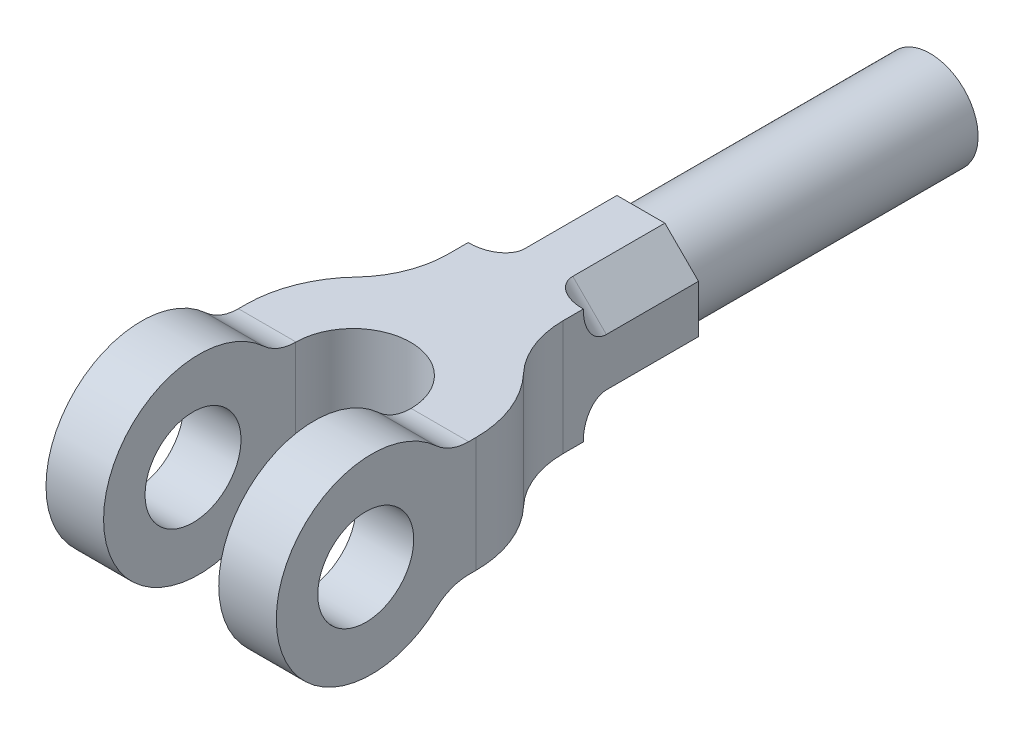
from build123d import *
from build123d.topology import SkipClean

# Parameters (mm, degrees)
SKETCH2_W                = 120
SKETCH2_H                = 250
BOSS_EXTRUDE1_DEPTH      = 50
CUT_EXTRUDE1_DEPTH       = 295.78805946
CUT_EXTRUDE1_DEPTH_BACK  = 295.78805946
CUT_EXTRUDE2_DEPTH       = 100
CUT_EXTRUDE3_DEPTH       = 282.780056072
CUT_EXTRUDE3_DEPTH_BACK  = 282.780056072
FILLET1_R                = 25
CUT_EXTRUDE5_DEPTH       = 60
FILLET4_R                = 12
SKETCH8_R                = 25
BOSS_EXTRUDE2_DEPTH      = 150.7
CUT_EXTRUDE11_DEPTH      = 422.260596346
CUT_EXTRUDE11_DEPTH_BACK = 422.260596346
SKETCH9_R                = 25


with BuildPart() as part:
    # Sketch2 → Boss-Extrude1 (new, symmetric)
    with BuildSketch(Plane(origin=(0, 0, 0), x_dir=(1, 0, 0), z_dir=(0, 1, 0))):
        with Locations((-60, 125)):
            Rectangle(SKETCH2_W, SKETCH2_H)
    extrude(amount=BOSS_EXTRUDE1_DEPTH, both=True)

    # Sketch3 → Cut-Extrude1 (cut, two sides: drawn at the far end of the back side and taken through both)
    with BuildSketch(Plane(origin=(0, 50, 0), x_dir=(1, 0, 0), z_dir=(0, 1, 0)).offset(-CUT_EXTRUDE1_DEPTH_BACK)):
        with BuildLine():
            ThreePointArc((-30, 100), (-60, 130), (-90, 100))
            Line((-90, 100), (-90, 0))
            Line((-90, 0), (-30, 0))
            Line((-30, 0), (-30, 100))
        make_face()
        with BuildLine():
            Line((-120, 250), (-120, 104))
            ThreePointArc((-120, 104), (-115.759222637, 126.156468376), (-103.636363636, 145.180915101))
            ThreePointArc((-103.636363636, 145.180915101), (-93.533981136, 161.034620706), (-90, 179.498344353))
            Line((-90, 179.498344353), (-90, 250))
            Line((-90, 250), (-120, 250))
        make_face()
        with BuildLine():
            ThreePointArc((-16.363636364, 145.180915101), (-4.240777363, 126.156468376), (0, 104))
            Line((0, 104), (0, 250))
            Line((0, 250), (-30, 250))
            Line((-30, 250), (-30, 179.498344353))
            ThreePointArc((-30, 179.498344353), (-26.466018864, 161.034620706), (-16.363636364, 145.180915101))
        make_face()
    extrude(amount=CUT_EXTRUDE1_DEPTH + CUT_EXTRUDE1_DEPTH_BACK, mode=Mode.SUBTRACT)

    # Sketch4 → Cut-Extrude2 (cut)
    with BuildSketch(Plane(origin=(0, 0, 0), x_dir=(0, 0, -1), z_dir=(1, 0, 0))):
        with BuildLine():
            ThreePointArc((89.331663554, -30.296760633), (71.831443345, -44.802429848), (49.703239367, -50))
            Line((49.703239367, -50), (250, -50))
            Line((250, -50), (250, -30.296760633))
            Line((250, -30.296760633), (89.331663554, -30.296760633))
        make_face()
        with BuildLine():
            Line((0, -50), (49.703239367, -50))
            ThreePointArc((49.703239367, -50), (14.557741777, -35.442258249), (0, -0.29676067))
            Line((0, -0.29676067), (0, -50))
        make_face()
        with BuildLine():
            Line((0, 50), (0, -0.29676067))
            ThreePointArc((0, -0.29676067), (33.879981934, 46.820502952), (89.331663554, 29.703239367))
            Line((89.331663554, 29.703239367), (250, 29.703239367))
            Line((250, 29.703239367), (250, 50))
            Line((250, 50), (0, 50))
        make_face()
    extrude(amount=-CUT_EXTRUDE2_DEPTH, mode=Mode.SUBTRACT)

    # Sketch5 → Cut-Extrude3 (cut, two sides: drawn at the far end of the back side and taken through both)
    with SkipClean():  # the faces are left unmerged after this step: merging them gives an invalid solid
        with BuildSketch(Plane(origin=(0, 0, 0), x_dir=(0, 0, -1), z_dir=(1, 0, 0)).offset(-CUT_EXTRUDE3_DEPTH_BACK)):
            with BuildLine():
                Line((89.331663554, 29.703239367), (149.498344353, 29.703239367))
                Line((149.498344353, 29.703239367), (149.498344353, 50))
                Line((149.498344353, 50), (0, 50))
                Line((0, 50), (0, -0.296760633))
                ThreePointArc((0, -0.296760633), (33.879981952, 46.820502958), (89.331663554, 29.703239367))
            make_face()
            with BuildLine():
                Line((149.498344353, -30.296760633), (89.331663554, -30.296760633))
                ThreePointArc((89.331663554, -30.296760633), (71.831443345, -44.802429848), (49.703239367, -50))
                Line((49.703239367, -50), (149.498344353, -50))
                Line((149.498344353, -50), (149.498344353, -30.296760633))
            make_face()
            with BuildLine():
                ThreePointArc((49.703239367, -50), (14.557741764, -35.442258236), (0, -0.296760633))
                Line((0, -0.296760633), (0, -50))
                Line((0, -50), (49.703239367, -50))
            make_face()
        extrude(amount=CUT_EXTRUDE3_DEPTH + CUT_EXTRUDE3_DEPTH_BACK, mode=Mode.SUBTRACT)

    # Fillet1
    fillet1_edges = [part.edges().sort_by_distance(p)[0] for p in [
        (-15, -30.296760633, -89.331663554),
    ]]
    fillet(fillet1_edges, radius=FILLET1_R)
    fillet1_2_edges = [part.edges().sort_by_distance(p)[0] for p in [
        (-95, -30.296760633, -89.331663554),
        (-110, -30.296760633, -89.331663554),
    ]]
    fillet(fillet1_2_edges, radius=FILLET1_R)
    fillet1_3_edges = [part.edges().sort_by_distance(p)[0] for p in [
        (-95, 29.703239367, -89.331663554),
        (-110, 29.703239367, -89.331663554),
    ]]
    fillet(fillet1_3_edges, radius=FILLET1_R)
    fillet1_4_edges = [part.edges().sort_by_distance(p)[0] for p in [
        (-15, 29.703239367, -89.331663554),
    ]]
    fillet(fillet1_4_edges, radius=FILLET1_R)

    # Sketch6 → Cut-Extrude5 (cut)
    with BuildSketch(Plane(origin=(0, 0, -250), x_dir=(-1, 0, 0), z_dir=(0, 0, -1))):
        Polygon((90, 12.203239367), (90, 29.703239367), (72.5, 29.703239367), align=None)
        Polygon((90, -30.296760633), (90, -12.796760633), (72.5, -30.296760633), align=None)
        Polygon((47.5, -30.296760633), (30, -12.796760633), (30, -30.296760633), align=None)
        Polygon((30, 12.203239367), (47.5, 29.703239367), (30, 29.703239367), align=None)
    extrude(amount=-CUT_EXTRUDE5_DEPTH, mode=Mode.SUBTRACT)

    # Fillet4
    fillet4_edges = [part.edges().sort_by_distance(p)[0] for p in [
        (-81.25, -21.546760633, -190),
        (-81.25, 20.953239367, -190),
        (-38.75, -21.546760633, -190),
        (-38.75, 20.953239367, -190),
    ]]
    fillet(fillet4_edges, radius=FILLET4_R)

    # Sketch8 → Boss-Extrude2 (add)
    with BuildSketch(Plane(origin=(0, 0, -250), x_dir=(-1, 0, 0), z_dir=(0, 0, -1))):
        with Locations((60, -0.296760633)):
            Circle(SKETCH8_R)
    extrude(amount=BOSS_EXTRUDE2_DEPTH)

    # Sketch9 → Cut-Extrude11 (cut, two sides: drawn at the far end of the back side and taken through both)
    with BuildSketch(Plane.ZY.offset(120).offset(-CUT_EXTRUDE11_DEPTH_BACK)):
        with Locations((-46.609873597, -0.035297833)):
            Circle(SKETCH9_R)
    extrude(amount=CUT_EXTRUDE11_DEPTH + CUT_EXTRUDE11_DEPTH_BACK, mode=Mode.SUBTRACT)


solid = part.part
